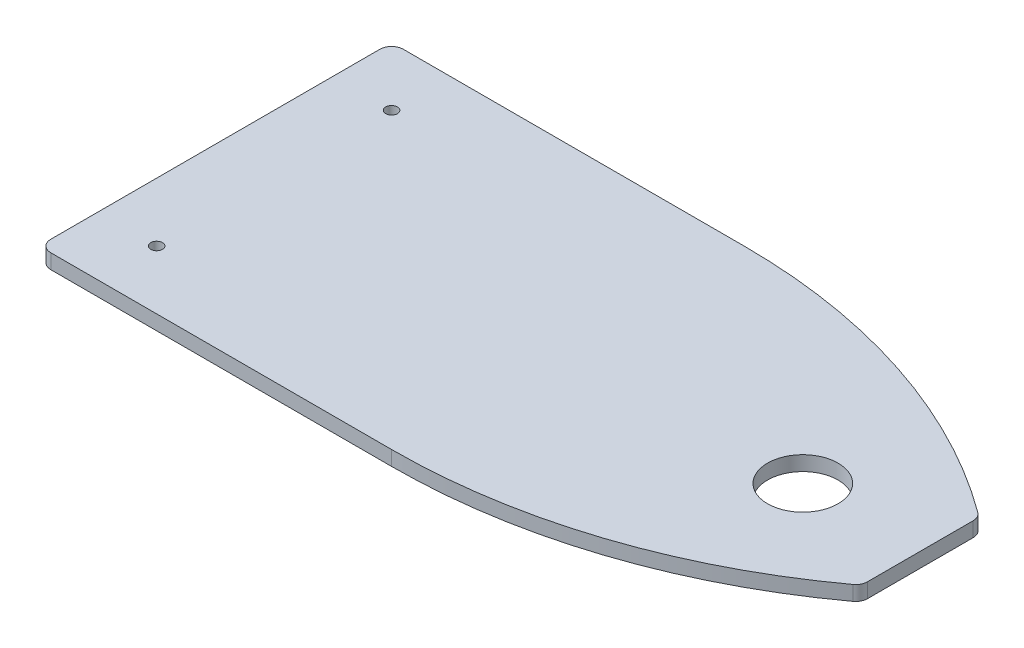
from build123d import *

# Parameters (mm, degrees)
SKETCH1_W           = 152.4
SKETCH1_H           = 76.2
BOSS_EXTRUDE1_DEPTH = 3.175
CUT_EXTRUDE1_DEPTH  = 3.175
FILLET2_R           = 2.54
FILLET3_R           = 2.54
SKETCH5_R           = 7.62
CUT_EXTRUDE2_DEPTH  = 3.175
SKETCH6_R           = 1.27
CUT_EXTRUDE3_DEPTH  = 3.175


with BuildPart() as part:
    # Sketch1 → Boss-Extrude1 (new body)
    with BuildSketch(Plane(origin=(0, 0, 0), x_dir=(1, 0, 0), z_dir=(0, 1, 0))):
        Rectangle(SKETCH1_W, SKETCH1_H)
    extrude(amount=BOSS_EXTRUDE1_DEPTH)

    # Sketch4 → Cut-Extrude1 (cut)
    with BuildSketch(Plane(origin=(0, 3.175, 0), x_dir=(1, 0, 0), z_dir=(0, 1, 0))):
        with BuildLine():
            Line((0, 38.1), (76.2, 38.1))
            Line((76.2, 38.1), (76.2, 12.7))
            ThreePointArc((76.2, 12.7), (40.160926284, 31.582778852), (0, 38.1))
        make_face()
        with BuildLine():
            Line((76.2, -38.1), (76.2, -12.7))
            ThreePointArc((76.2, -12.7), (40.160926284, -31.582778852), (0, -38.1))
            Line((0, -38.1), (76.2, -38.1))
        make_face()
    extrude(amount=-CUT_EXTRUDE1_DEPTH, mode=Mode.SUBTRACT)

    # Fillet2
    fillet2_edges = [part.edges().sort_by_distance(p)[0] for p in [
        (76.2, 1.5875, 12.7),
        (76.2, 1.5875, -12.7),
    ]]
    fillet(fillet2_edges, radius=FILLET2_R)

    # Fillet3
    fillet3_edges = [part.edges().sort_by_distance(p)[0] for p in [
        (-76.2, 1.5875, 38.1),
        (-76.2, 1.5875, -38.1),
    ]]
    fillet(fillet3_edges, radius=FILLET3_R)

    # Sketch5 → Cut-Extrude2 (cut)
    with BuildSketch(Plane(origin=(0, 3.175, 0), x_dir=(1, 0, 0), z_dir=(0, 1, 0))):
        with Locations((50.8, 0)):
            Circle(SKETCH5_R)
    extrude(amount=-CUT_EXTRUDE2_DEPTH, mode=Mode.SUBTRACT)

    # Sketch6 → Cut-Extrude3 (cut)
    with BuildSketch(Plane(origin=(0, 3.175, 0), x_dir=(1, 0, 0), z_dir=(0, 1, 0))):
        with Locations((-63.5, 25.4)):
            Circle(SKETCH6_R)
        with Locations((-63.5, -25.4)):
            Circle(SKETCH6_R)
    extrude(amount=-CUT_EXTRUDE3_DEPTH, mode=Mode.SUBTRACT)


solid = part.part
